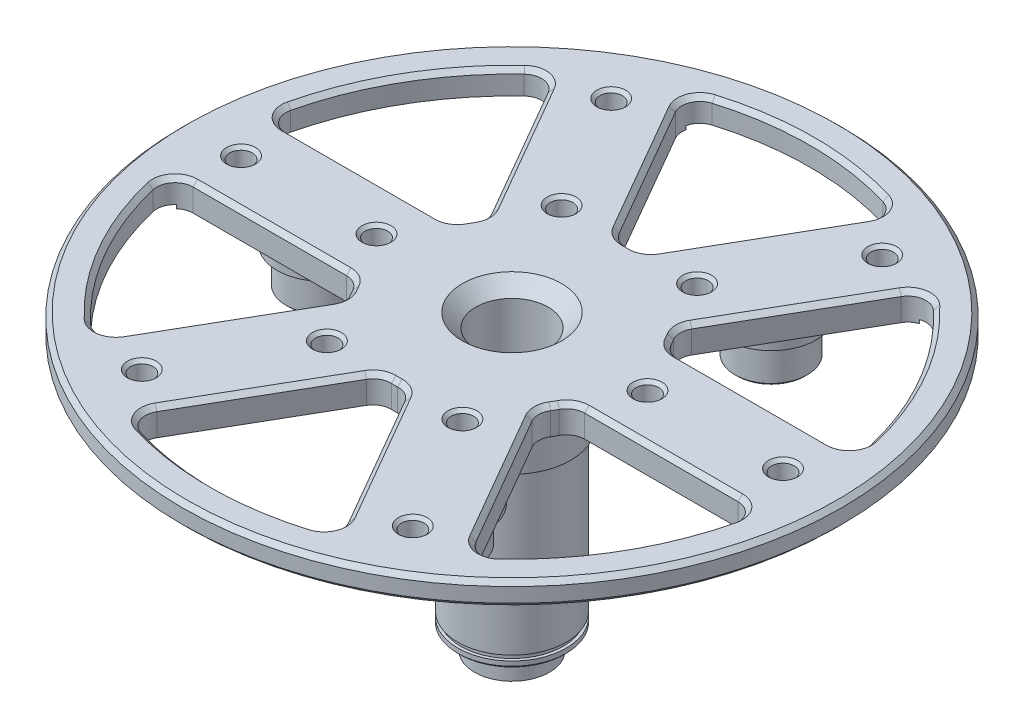
from build123d import *

# Parameters (mm, degrees)
CHAMFER1_SIZE                   = 0.5
CHAMFER2_SIZE                   = 0.25
CIRPATTERN1_COUNT               = 3
CHAMFER2_OF_CIRPATTERN1_SIZE    = 0.25
CHAMFER3_SIZE                   = 0.25
CHAMFER4_SIZE                   = 0.5
M3X0_5_TAPPED_HOLE1_D           = 2.5
M3X0_5_TAPPED_HOLE1_CSINK_D     = 3.2
M3X0_5_TAPPED_HOLE1_CSINK_ANGLE = 90
M3X0_5_TAPPED_HOLE2_D           = 2.5
M3X0_5_TAPPED_HOLE2_CSINK_D     = 3.2
M3X0_5_TAPPED_HOLE2_CSINK_ANGLE = 90
CIRPATTERN2_COUNT               = 6
CUT_EXTRUDE1_DEPTH              = 57.490729328
FILLET1_R                       = 2
CHAMFER5_SIZE                   = 0.5
CIRPATTERN3_COUNT               = 6
FILLET1_OF_CIRPATTERN3_R        = 2
CHAMFER5_OF_CIRPATTERN3_SIZE    = 0.5


with BuildPart() as part:
    # Sketch1 → Revolve1 (revolve)
    with BuildSketch(Plane.XY, mode=Mode.PRIVATE) as revolve1_sk:
        Polygon((-2.5, -6), (-4, -6), (-4, 21.45), (-5.5, 22.95), (-36.5, 22.95), (-36.5, 20.35), (-32, 20.35), (-32, 19.95), (-6.5, 19.95), (-6.5, 12), (-6, 12), (-6, -5.69), (-5.67, -5.69), (-5.67, -6.25), (-6, -6.25), (-6, -7), (-4.15, -7), (-4.15, -9.5), (-2.5, -9.5), align=None)
    revolve(revolve1_sk.sketch.rotate(Axis((0, 0, 0), (0, -1, 0)), 270), axis=Axis((0, 0, 0), (0, -1, 0)))

    # Chamfer1
    chamfer1_edges = [part.edges().sort_by_distance(p)[0] for p in [
        (0, -9.5, -2.5),
    ]]
    chamfer(chamfer1_edges, length=CHAMFER1_SIZE)

    # Sketch2 → Planet bearing axis (revolve)
    with BuildSketch(Plane.XY):
        Polygon((-21, 19.95), (-26, 19.95), (-26, 18.95), (-25, 18.95), (-25, 14.85), (-21, 14.85), align=None)
    planet_bearing_axis = revolve(axis=Axis((-21, 33.164090746, 0), (0, -1, 0)))

    # Chamfer2
    chamfer2_edges = [part.edges().sort_by_distance(p)[0] for p in [
        (-17, 14.85, 0),
    ]]
    chamfer(chamfer2_edges, length=CHAMFER2_SIZE)

    # CirPattern1: Planet bearing axis ×3 about axis
    cirpattern1_axis = Axis((0, 0, 0), (0, 1, 0))
    for i in range(1, CIRPATTERN1_COUNT):
        add(planet_bearing_axis.rotate(cirpattern1_axis, i * 360 / CIRPATTERN1_COUNT))

    # Chamfer2 of CirPattern1
    chamfer2_of_cirpattern1_edges = [part.edges().sort_by_distance(p)[0] for p in [
        (8.5, 14.85, 14.722431864),
        (8.5, 14.85, -14.722431864),
    ]]
    chamfer(chamfer2_of_cirpattern1_edges, length=CHAMFER2_OF_CIRPATTERN1_SIZE)

    # Chamfer3
    chamfer3_edges = [part.edges().sort_by_distance(p)[0] for p in [
        (0, -7, -6),
    ]]
    chamfer(chamfer3_edges, length=CHAMFER3_SIZE)

    # Chamfer4
    chamfer4_edges = [part.edges().sort_by_distance(p)[0] for p in [
        (0, 19.95, -6.5),
        (0, 20.35, -36.5),
        (0, 22.95, -36.5),
    ]]
    chamfer(chamfer4_edges, length=CHAMFER4_SIZE)

    # M3x0.5 Tapped Hole1 (through all)
    with Locations(Plane(origin=(0, 22.95, 0), x_dir=(1, 0, 0), z_dir=(0, 1, 0))):
        with Locations((-30, 0)):
            m3x0_5_tapped_hole1 = CounterSinkHole(M3X0_5_TAPPED_HOLE1_D / 2, M3X0_5_TAPPED_HOLE1_CSINK_D / 2, counter_sink_angle=M3X0_5_TAPPED_HOLE1_CSINK_ANGLE)

    # M3x0.5 Tapped Hole2 (through all)
    with Locations(Plane(origin=(0, 22.95, 0), x_dir=(1, 0, 0), z_dir=(0, 1, 0))):
        with Locations((-15, 0)):
            m3x0_5_tapped_hole2 = CounterSinkHole(M3X0_5_TAPPED_HOLE2_D / 2, M3X0_5_TAPPED_HOLE2_CSINK_D / 2, counter_sink_angle=M3X0_5_TAPPED_HOLE2_CSINK_ANGLE)

    # CirPattern2: M3x0.5 Tapped Hole1, M3x0.5 Tapped Hole2 ×6 about axis
    cirpattern2_axis = Axis((0, 0, 0), (0, 1, 0))
    add([m3x0_5_tapped_hole1.rotate(cirpattern2_axis, i * 360 / CIRPATTERN2_COUNT) for i in range(1, CIRPATTERN2_COUNT)], mode=Mode.SUBTRACT)
    add([m3x0_5_tapped_hole2.rotate(cirpattern2_axis, i * 360 / CIRPATTERN2_COUNT) for i in range(1, CIRPATTERN2_COUNT)], mode=Mode.SUBTRACT)

    # Sketch7 → Cut-Extrude1 (cut, through all)
    with BuildSketch(Plane(origin=(0, 0, 0), x_dir=(1, 0, 0), z_dir=(0, 1, 0))):
        with BuildLine():
            Line((-20.758359751, -25.653274653), (-10.428637185, -7.76167034))
            ThreePointArc((-10.428637185, -7.76167034), (-11.258330249, -6.5), (-11.936122283, -5.150629559))
            Line((-11.936122283, -5.150629559), (-32.595567416, -5.150629559))
            ThreePointArc((-32.595567416, -5.150629559), (-28.578838325, -16.5), (-20.758359751, -25.653274653))
        make_face()
    cut_extrude1 = extrude(amount=CUT_EXTRUDE1_DEPTH, mode=Mode.SUBTRACT)

    # Fillet1
    # the kernel refuses this fillet: 2 mm, written as the material it adds along each edge
    with BuildSketch(Plane(origin=(-20.758359751, 14.078120483, 25.653274653), x_dir=(-0.7528994258990811, 0, -0.6581355897387968), z_dir=(0, 1, 0))) as fillet1_piece_1_section:
        with BuildLine():
            CenterArc((2.432729025, -1.998554612), FILLET1_R, 87.82158292, 103.336253881)
            Line((0.470533377, -2.385579466), (0, 0))
            ThreePointArc((0, 0), (1.254375903, 0.023848904), (2.508751807, 0))
        make_face()
    fillet1_piece_1 = extrude(amount=8.871879517, mode=Mode.PRIVATE)
    fillet1_piece_1 = split(fillet1_piece_1, bisect_by=Plane(origin=(-20.132712931, 19.95, 24.335112466), z_dir=(0, 1, 0)), keep=Keep.TOP, mode=Mode.PRIVATE)
    fillet1_piece_1 = fillet1_piece_1 & Plane(origin=(0, 20.15, 0), x_dir=(0, 0, 1), z_dir=(0, -1, 0)) * Cylinder(32, 28, mode=Mode.PRIVATE)
    fillet1_piece_1 = split(fillet1_piece_1, bisect_by=Plane(origin=(-20.132712931, 20.35, 24.335112466), z_dir=(0, -1, 0)), keep=Keep.TOP, mode=Mode.PRIVATE)
    add(fillet1_piece_1)
    with BuildSketch(Plane(origin=(-20.758359751, 20.35, 25.653274653), x_dir=(-0.7528994258990804, 0, -0.6581355897387977), z_dir=(0, 1, 0))) as fillet1_piece_2_section:
        with BuildLine():
            CenterArc((2.432729025, -1.998554612), FILLET1_R, 87.82158292, 103.336253881)
            Line((0.470533377, -2.385579466), (0, 0))
            ThreePointArc((0, 0), (1.254375903, 0.023848904), (2.508751807, 0))
        make_face()
    fillet1_piece_2 = extrude(amount=2.6, mode=Mode.PRIVATE)
    fillet1_piece_2 = fillet1_piece_2 - Plane(origin=(0, 21.65, 0), x_dir=(0, 0, 1), z_dir=(0, -1, 0)) * Cylinder(32, 16, mode=Mode.PRIVATE)
    add(fillet1_piece_2)
    with BuildSketch(Plane(origin=(-20.758359751, 20.35, 25.653274653), x_dir=(-0.7528994258990804, 0, -0.6581355897387977), z_dir=(0, 1, 0))) as fillet1_piece_3_section:
        with BuildLine():
            CenterArc((2.432729025, -1.998554612), FILLET1_R, 87.82158292, 103.336253881)
            Line((0.470533377, -2.385579466), (0, 0))
            ThreePointArc((0, 0), (1.254375903, 0.023848904), (2.508751807, 0))
        make_face()
    fillet1_piece_3 = extrude(amount=2.6, mode=Mode.PRIVATE)
    fillet1_piece_3 = fillet1_piece_3 & Plane(origin=(0, 21.65, 0), x_dir=(0, 0, 1), z_dir=(0, -1, 0)) * Cylinder(32, 16, mode=Mode.PRIVATE)
    add(fillet1_piece_3)
    with BuildSketch(Plane(origin=(-32.595567416, 14.078120483, 5.150629559), x_dir=(0.19351242689891437, 0, 0.9810978241927216), z_dir=(0, 1, 0))) as fillet1_piece_4_section:
        with BuildLine():
            CenterArc((2.432729025, 1.998554612), FILLET1_R, 168.842163199, 103.336253881)
            Line((0.470533377, 2.385579466), (0, 0))
            ThreePointArc((0, 0), (1.254375903, -0.023848904), (2.508751807, 0))
        make_face()
    fillet1_piece_4 = extrude(amount=8.871879517, mode=Mode.PRIVATE)
    fillet1_piece_4 = split(fillet1_piece_4, bisect_by=Plane(origin=(-31.141182065, 19.95, 5.267884612), z_dir=(0, 1, 0)), keep=Keep.TOP, mode=Mode.PRIVATE)
    fillet1_piece_4 = fillet1_piece_4 & Plane(origin=(0, 20.15, 0), x_dir=(0, 0, 1), z_dir=(0, -1, 0)) * Cylinder(32, 28, mode=Mode.PRIVATE)
    fillet1_piece_4 = split(fillet1_piece_4, bisect_by=Plane(origin=(-31.141182065, 20.35, 5.267884612), z_dir=(0, -1, 0)), keep=Keep.TOP, mode=Mode.PRIVATE)
    add(fillet1_piece_4)
    with BuildSketch(Plane(origin=(-32.595567416, 20.35, 5.150629559), x_dir=(0.19351242689891449, 0, 0.9810978241927214), z_dir=(0, 1, 0))) as fillet1_piece_5_section:
        with BuildLine():
            CenterArc((2.432729025, 1.998554612), FILLET1_R, 168.842163199, 103.336253881)
            Line((0.470533377, 2.385579466), (0, 0))
            ThreePointArc((0, 0), (1.254375903, -0.023848904), (2.508751807, 0))
        make_face()
    fillet1_piece_5 = extrude(amount=2.6, mode=Mode.PRIVATE)
    fillet1_piece_5 = fillet1_piece_5 - Plane(origin=(0, 21.65, 0), x_dir=(0, 0, 1), z_dir=(0, -1, 0)) * Cylinder(32, 16, mode=Mode.PRIVATE)
    add(fillet1_piece_5)
    with BuildSketch(Plane(origin=(-32.595567416, 20.35, 5.150629559), x_dir=(0.19351242689891449, 0, 0.9810978241927214), z_dir=(0, 1, 0))) as fillet1_piece_6_section:
        with BuildLine():
            CenterArc((2.432729025, 1.998554612), FILLET1_R, 168.842163199, 103.336253881)
            Line((0.470533377, 2.385579466), (0, 0))
            ThreePointArc((0, 0), (1.254375903, -0.023848904), (2.508751807, 0))
        make_face()
    fillet1_piece_6 = extrude(amount=2.6, mode=Mode.PRIVATE)
    fillet1_piece_6 = fillet1_piece_6 & Plane(origin=(0, 21.65, 0), x_dir=(0, 0, 1), z_dir=(0, -1, 0)) * Cylinder(32, 16, mode=Mode.PRIVATE)
    add(fillet1_piece_6)
    with BuildSketch(Plane(origin=(-10.428637185, 19.95, 7.76167034), x_dir=(-0.5605549109319616, 0, -0.8281172572951614), z_dir=(0, 1, 0))) as fillet1_piece_7:
        with BuildLine():
            CenterArc((1.252998634, 1.997996438), FILLET1_R, 205.905817779, 61.529342356)
            Line((-0.546028209, 1.124210185), (0, 0))
            ThreePointArc((0, 0), (0.581749366, 0.013023151), (1.163498732, 0))
        make_face()
    extrude(amount=3)
    with BuildSketch(Plane(origin=(-11.936122283, 19.95, 5.150629559), x_dir=(-1, 0, 0), z_dir=(0, 1, 0))) as fillet1_piece_8:
        with BuildLine():
            CenterArc((1.249798122, 2), FILLET1_R, 208.470657644, 61.529342356)
            ThreePointArc((-0.508324599, 1.046582726), (-0.2424478, 0.528981088), (0, 0))
            Line((0, 0), (1.249798122, 0))
        make_face()
    extrude(amount=3)

    # Chamfer5
    chamfer5_edges = [part.edges().sort_by_distance(p)[0] for p in [
        (-28.578838325, 22.95, 16.5),
        (-15.298062779, 22.95, 16.195762873),
        (-21.674973471, 22.95, 5.150629559),
        (-11.258330249, 22.95, 6.5),
        (-20.984826836, 22.95, 24.526389146),
        (-31.732889482, 22.95, 5.910198561),
        (-10.785765167, 22.95, 7.817335996),
        (-12.162894146, 22.95, 5.432078636),
    ]]
    chamfer(chamfer5_edges, length=CHAMFER5_SIZE)

    # CirPattern3: Cut-Extrude1 ×6 about axis
    cirpattern3_axis = Axis((0, 0, 0), (0, 1, 0))
    for i in range(1, CIRPATTERN3_COUNT):
        add(cut_extrude1.rotate(cirpattern3_axis, i * 360 / CIRPATTERN3_COUNT), mode=Mode.SUBTRACT)

    # Fillet1 of CirPattern3
    # the kernel refuses this fillet: 2 mm, written as the material it adds along each edge
    with BuildSketch(Plane(origin=(11.837207665, 14.078120483, 30.803904212), x_dir=(-0.499999999999998, 0, -0.8660254037844397), z_dir=(0, 1, 0))) as fillet1_of_cirpattern3_piece_1_section:
        with BuildLine():
            CenterArc((2.431540879, 2), FILLET1_OF_CIRPATTERN3_R, 166.663746119, 103.336253881)
            ThreePointArc((0.485474651, 2.461330939), (0.219339217, 1.235280529), (0, 0))
            Line((0, 0), (2.431540879, 0))
        make_face()
    fillet1_of_cirpattern3_piece_1 = extrude(amount=8.871879517, mode=Mode.PRIVATE)
    fillet1_of_cirpattern3_piece_1 = split(fillet1_of_cirpattern3_piece_1, bisect_by=Plane(origin=(11.008469134, 19.95, 29.602997078), z_dir=(0, 1, 0)), keep=Keep.TOP, mode=Mode.PRIVATE)
    fillet1_of_cirpattern3_piece_1 = split(fillet1_of_cirpattern3_piece_1, bisect_by=Plane(origin=(11.008469134, 20.35, 29.602997078), z_dir=(0, -1, 0)), keep=Keep.TOP, mode=Mode.PRIVATE)
    fillet1_of_cirpattern3_piece_1 = fillet1_of_cirpattern3_piece_1 & Plane(origin=(0, 20.15, 0), x_dir=(0, 0, 1), z_dir=(0, -1, 0)) * Cylinder(32, 28, mode=Mode.PRIVATE)
    add(fillet1_of_cirpattern3_piece_1)
    with BuildSketch(Plane(origin=(11.837207665, 20.35, 30.803904212), x_dir=(-0.499999999999998, 0, -0.8660254037844397), z_dir=(0, 1, 0))) as fillet1_of_cirpattern3_piece_2_section:
        with BuildLine():
            CenterArc((2.431540879, 2), FILLET1_OF_CIRPATTERN3_R, 166.663746119, 103.336253881)
            ThreePointArc((0.485474651, 2.461330939), (0.219339217, 1.235280529), (0, 0))
            Line((0, 0), (2.431540879, 0))
        make_face()
    fillet1_of_cirpattern3_piece_2 = extrude(amount=2.6, mode=Mode.PRIVATE)
    fillet1_of_cirpattern3_piece_2 = fillet1_of_cirpattern3_piece_2 & Plane(origin=(0, 21.65, 0), x_dir=(0, 0, 1), z_dir=(0, -1, 0)) * Cylinder(32, 16, mode=Mode.PRIVATE)
    add(fillet1_of_cirpattern3_piece_2)
    with BuildSketch(Plane(origin=(11.837207665, 20.35, 30.803904212), x_dir=(-0.499999999999998, 0, -0.8660254037844397), z_dir=(0, 1, 0))) as fillet1_of_cirpattern3_piece_3_section:
        with BuildLine():
            CenterArc((2.431540879, 2), FILLET1_OF_CIRPATTERN3_R, 166.663746119, 103.336253881)
            ThreePointArc((0.485474651, 2.461330939), (0.219339217, 1.235280529), (0, 0))
            Line((0, 0), (2.431540879, 0))
        make_face()
    fillet1_of_cirpattern3_piece_3 = extrude(amount=2.6, mode=Mode.PRIVATE)
    fillet1_of_cirpattern3_piece_3 = fillet1_of_cirpattern3_piece_3 - Plane(origin=(0, 21.65, 0), x_dir=(0, 0, 1), z_dir=(0, -1, 0)) * Cylinder(32, 16, mode=Mode.PRIVATE)
    add(fillet1_of_cirpattern3_piece_3)
    with BuildSketch(Plane(origin=(-11.837207665, 14.078120483, 30.803904212), x_dir=(0.49999999999999845, 0, -0.8660254037844395), z_dir=(0, 1, 0))) as fillet1_of_cirpattern3_piece_4_section:
        with BuildLine():
            CenterArc((2.431540879, -2), FILLET1_OF_CIRPATTERN3_R, 90, 103.336253881)
            ThreePointArc((0.485474651, -2.461330939), (0.219339217, -1.235280529), (0, 0))
            Line((0, 0), (2.431540879, 0))
        make_face()
    fillet1_of_cirpattern3_piece_4 = extrude(amount=8.871879517, mode=Mode.PRIVATE)
    fillet1_of_cirpattern3_piece_4 = split(fillet1_of_cirpattern3_piece_4, bisect_by=Plane(origin=(-11.008469134, 19.95, 29.602997078), z_dir=(0, 1, 0)), keep=Keep.TOP, mode=Mode.PRIVATE)
    fillet1_of_cirpattern3_piece_4 = fillet1_of_cirpattern3_piece_4 & Plane(origin=(0, 20.15, 0), x_dir=(0, 0, 1), z_dir=(0, -1, 0)) * Cylinder(32, 28, mode=Mode.PRIVATE)
    fillet1_of_cirpattern3_piece_4 = split(fillet1_of_cirpattern3_piece_4, bisect_by=Plane(origin=(-11.008469134, 20.35, 29.602997078), z_dir=(0, -1, 0)), keep=Keep.TOP, mode=Mode.PRIVATE)
    add(fillet1_of_cirpattern3_piece_4)
    with BuildSketch(Plane(origin=(-11.837207665, 20.35, 30.803904212), x_dir=(0.499999999999998, 0, -0.8660254037844397), z_dir=(0, 1, 0))) as fillet1_of_cirpattern3_piece_5_section:
        with BuildLine():
            CenterArc((2.431540879, -2), FILLET1_OF_CIRPATTERN3_R, 90, 103.336253881)
            ThreePointArc((0.485474651, -2.461330939), (0.219339217, -1.235280529), (0, 0))
            Line((0, 0), (2.431540879, 0))
        make_face()
    fillet1_of_cirpattern3_piece_5 = extrude(amount=2.6, mode=Mode.PRIVATE)
    fillet1_of_cirpattern3_piece_5 = fillet1_of_cirpattern3_piece_5 & Plane(origin=(0, 21.65, 0), x_dir=(0, 0, 1), z_dir=(0, -1, 0)) * Cylinder(32, 16, mode=Mode.PRIVATE)
    add(fillet1_of_cirpattern3_piece_5)
    with BuildSketch(Plane(origin=(-11.837207665, 20.35, 30.803904212), x_dir=(0.499999999999998, 0, -0.8660254037844397), z_dir=(0, 1, 0))) as fillet1_of_cirpattern3_piece_6_section:
        with BuildLine():
            CenterArc((2.431540879, -2), FILLET1_OF_CIRPATTERN3_R, 90, 103.336253881)
            ThreePointArc((0.485474651, -2.461330939), (0.219339217, -1.235280529), (0, 0))
            Line((0, 0), (2.431540879, 0))
        make_face()
    fillet1_of_cirpattern3_piece_6 = extrude(amount=2.6, mode=Mode.PRIVATE)
    fillet1_of_cirpattern3_piece_6 = fillet1_of_cirpattern3_piece_6 - Plane(origin=(0, 21.65, 0), x_dir=(0, 0, 1), z_dir=(0, -1, 0)) * Cylinder(32, 16, mode=Mode.PRIVATE)
    add(fillet1_of_cirpattern3_piece_6)
    with BuildSketch(Plane(origin=(1.507485098, 19.95, 12.912299899), x_dir=(-0.997448037595885, 0, 0.07139616443561987), z_dir=(0, 1, 0)), Plane(origin=(11.936122283, 19.95, 5.150629559), x_dir=(-0.43689312666392316, 0, 0.8995134217307829), z_dir=(0, 1, 0)), Plane(origin=(10.428637185, 19.95, -7.76167034), x_dir=(0.5605549109319609, 0, 0.828117257295162), z_dir=(0, 1, 0)), Plane(origin=(-1.507485098, 19.95, -12.912299899), x_dir=(0.997448037595885, 0, -0.07139616443562116), z_dir=(0, 1, 0)), Plane(origin=(-11.936122283, 19.95, -5.150629559), x_dir=(0.43689312666392466, 0, -0.8995134217307821), z_dir=(0, 1, 0))) as fillet1_of_cirpattern3_piece_7:
        with BuildLine():
            CenterArc((1.252998634, 1.997996438), FILLET1_OF_CIRPATTERN3_R, 205.905817779, 61.529342356)
            Line((-0.546028209, 1.124210185), (0, 0))
            ThreePointArc((0, 0), (0.581749366, 0.013023151), (1.163498732, 0))
        make_face()
    extrude(amount=3)
    with BuildSketch(Plane(origin=(-1.507485098, 19.95, 12.912299899), x_dir=(-0.49999999999999867, 0, 0.8660254037844395), z_dir=(0, 1, 0)), Plane(origin=(10.428637185, 19.95, 7.76167034), x_dir=(0.5000000000000017, 0, 0.8660254037844377), z_dir=(0, 1, 0)), Plane(origin=(11.936122283, 19.95, -5.150629559), x_dir=(1, 0, 0), z_dir=(0, 1, 0)), Plane(origin=(1.507485098, 19.95, -12.912299899), x_dir=(0.499999999999999, 0, -0.8660254037844393), z_dir=(0, 1, 0)), Plane(origin=(-10.428637185, 19.95, -7.76167034), x_dir=(-0.5000000000000011, 0, -0.866025403784438), z_dir=(0, 1, 0))) as fillet1_of_cirpattern3_piece_8:
        with BuildLine():
            CenterArc((1.249798122, 2), FILLET1_OF_CIRPATTERN3_R, 208.470657644, 61.529342356)
            ThreePointArc((-0.508324599, 1.046582726), (-0.2424478, 0.528981088), (0, 0))
            Line((0, 0), (1.249798122, 0))
        make_face()
    extrude(amount=3)
    with BuildSketch(Plane(origin=(32.595567416, 14.078120483, 5.150629559), x_dir=(-1, 0, 0), z_dir=(0, 1, 0))) as fillet1_of_cirpattern3_piece_9_section:
        with BuildLine():
            CenterArc((2.431540879, 2), FILLET1_OF_CIRPATTERN3_R, 166.663746119, 103.336253881)
            ThreePointArc((0.485474651, 2.461330939), (0.219339217, 1.235280529), (0, 0))
            Line((0, 0), (2.431540879, 0))
        make_face()
    fillet1_of_cirpattern3_piece_9 = extrude(amount=8.871879517, mode=Mode.PRIVATE)
    fillet1_of_cirpattern3_piece_9 = split(fillet1_of_cirpattern3_piece_9, bisect_by=Plane(origin=(31.141182065, 19.95, 5.267884612), z_dir=(0, 1, 0)), keep=Keep.TOP, mode=Mode.PRIVATE)
    fillet1_of_cirpattern3_piece_9 = split(fillet1_of_cirpattern3_piece_9, bisect_by=Plane(origin=(31.141182065, 20.35, 5.267884612), z_dir=(0, -1, 0)), keep=Keep.TOP, mode=Mode.PRIVATE)
    fillet1_of_cirpattern3_piece_9 = fillet1_of_cirpattern3_piece_9 & Plane(origin=(0, 20.15, 0), x_dir=(0, 0, 1), z_dir=(0, -1, 0)) * Cylinder(32, 28, mode=Mode.PRIVATE)
    add(fillet1_of_cirpattern3_piece_9)
    with BuildSketch(Plane(origin=(32.595567416, 20.35, 5.150629559), x_dir=(-1, 0, 0), z_dir=(0, 1, 0))) as fillet1_of_cirpattern3_piece_10_section:
        with BuildLine():
            CenterArc((2.431540879, 2), FILLET1_OF_CIRPATTERN3_R, 166.663746119, 103.336253881)
            ThreePointArc((0.485474651, 2.461330939), (0.219339217, 1.235280529), (0, 0))
            Line((0, 0), (2.431540879, 0))
        make_face()
    fillet1_of_cirpattern3_piece_10 = extrude(amount=2.6, mode=Mode.PRIVATE)
    fillet1_of_cirpattern3_piece_10 = fillet1_of_cirpattern3_piece_10 & Plane(origin=(0, 21.65, 0), x_dir=(0, 0, 1), z_dir=(0, -1, 0)) * Cylinder(32, 16, mode=Mode.PRIVATE)
    add(fillet1_of_cirpattern3_piece_10)
    with BuildSketch(Plane(origin=(32.595567416, 20.35, 5.150629559), x_dir=(-1, 0, 0), z_dir=(0, 1, 0))) as fillet1_of_cirpattern3_piece_11_section:
        with BuildLine():
            CenterArc((2.431540879, 2), FILLET1_OF_CIRPATTERN3_R, 166.663746119, 103.336253881)
            ThreePointArc((0.485474651, 2.461330939), (0.219339217, 1.235280529), (0, 0))
            Line((0, 0), (2.431540879, 0))
        make_face()
    fillet1_of_cirpattern3_piece_11 = extrude(amount=2.6, mode=Mode.PRIVATE)
    fillet1_of_cirpattern3_piece_11 = fillet1_of_cirpattern3_piece_11 - Plane(origin=(0, 21.65, 0), x_dir=(0, 0, 1), z_dir=(0, -1, 0)) * Cylinder(32, 16, mode=Mode.PRIVATE)
    add(fillet1_of_cirpattern3_piece_11)
    with BuildSketch(Plane(origin=(20.758359751, 14.078120483, 25.653274653), x_dir=(-0.5000000000000023, 0, -0.8660254037844372), z_dir=(0, 1, 0))) as fillet1_of_cirpattern3_piece_12_section:
        with BuildLine():
            CenterArc((2.431540879, -2), FILLET1_OF_CIRPATTERN3_R, 90, 103.336253881)
            ThreePointArc((0.485474651, -2.461330939), (0.219339217, -1.235280529), (0, 0))
            Line((0, 0), (2.431540879, 0))
        make_face()
    fillet1_of_cirpattern3_piece_12 = extrude(amount=8.871879517, mode=Mode.PRIVATE)
    fillet1_of_cirpattern3_piece_12 = split(fillet1_of_cirpattern3_piece_12, bisect_by=Plane(origin=(20.132712931, 19.95, 24.335112466), z_dir=(0, 1, 0)), keep=Keep.TOP, mode=Mode.PRIVATE)
    fillet1_of_cirpattern3_piece_12 = fillet1_of_cirpattern3_piece_12 & Plane(origin=(0, 20.15, 0), x_dir=(0, 0, 1), z_dir=(0, -1, 0)) * Cylinder(32, 28, mode=Mode.PRIVATE)
    fillet1_of_cirpattern3_piece_12 = split(fillet1_of_cirpattern3_piece_12, bisect_by=Plane(origin=(20.132712931, 20.35, 24.335112466), z_dir=(0, -1, 0)), keep=Keep.TOP, mode=Mode.PRIVATE)
    add(fillet1_of_cirpattern3_piece_12)
    with BuildSketch(Plane(origin=(20.758359751, 20.35, 25.653274653), x_dir=(-0.5000000000000014, 0, -0.8660254037844377), z_dir=(0, 1, 0))) as fillet1_of_cirpattern3_piece_13_section:
        with BuildLine():
            CenterArc((2.431540879, -2), FILLET1_OF_CIRPATTERN3_R, 90, 103.336253881)
            ThreePointArc((0.485474651, -2.461330939), (0.219339217, -1.235280529), (0, 0))
            Line((0, 0), (2.431540879, 0))
        make_face()
    fillet1_of_cirpattern3_piece_13 = extrude(amount=2.6, mode=Mode.PRIVATE)
    fillet1_of_cirpattern3_piece_13 = fillet1_of_cirpattern3_piece_13 & Plane(origin=(0, 21.65, 0), x_dir=(0, 0, 1), z_dir=(0, -1, 0)) * Cylinder(32, 16, mode=Mode.PRIVATE)
    add(fillet1_of_cirpattern3_piece_13)
    with BuildSketch(Plane(origin=(20.758359751, 20.35, 25.653274653), x_dir=(-0.5000000000000014, 0, -0.8660254037844377), z_dir=(0, 1, 0))) as fillet1_of_cirpattern3_piece_14_section:
        with BuildLine():
            CenterArc((2.431540879, -2), FILLET1_OF_CIRPATTERN3_R, 90, 103.336253881)
            ThreePointArc((0.485474651, -2.461330939), (0.219339217, -1.235280529), (0, 0))
            Line((0, 0), (2.431540879, 0))
        make_face()
    fillet1_of_cirpattern3_piece_14 = extrude(amount=2.6, mode=Mode.PRIVATE)
    fillet1_of_cirpattern3_piece_14 = fillet1_of_cirpattern3_piece_14 - Plane(origin=(0, 21.65, 0), x_dir=(0, 0, 1), z_dir=(0, -1, 0)) * Cylinder(32, 16, mode=Mode.PRIVATE)
    add(fillet1_of_cirpattern3_piece_14)
    with BuildSketch(Plane(origin=(20.758359751, 14.078120483, -25.653274653), x_dir=(-0.5000000000000026, 0, 0.8660254037844372), z_dir=(0, 1, 0))) as fillet1_of_cirpattern3_piece_15_section:
        with BuildLine():
            CenterArc((2.431540879, 2), FILLET1_OF_CIRPATTERN3_R, 166.663746119, 103.336253881)
            ThreePointArc((0.485474651, 2.461330939), (0.219339217, 1.235280529), (0, 0))
            Line((0, 0), (2.431540879, 0))
        make_face()
    fillet1_of_cirpattern3_piece_15 = extrude(amount=8.871879517, mode=Mode.PRIVATE)
    fillet1_of_cirpattern3_piece_15 = split(fillet1_of_cirpattern3_piece_15, bisect_by=Plane(origin=(20.132712931, 19.95, -24.335112466), z_dir=(0, 1, 0)), keep=Keep.TOP, mode=Mode.PRIVATE)
    fillet1_of_cirpattern3_piece_15 = split(fillet1_of_cirpattern3_piece_15, bisect_by=Plane(origin=(20.132712931, 20.35, -24.335112466), z_dir=(0, -1, 0)), keep=Keep.TOP, mode=Mode.PRIVATE)
    fillet1_of_cirpattern3_piece_15 = fillet1_of_cirpattern3_piece_15 & Plane(origin=(0, 20.15, 0), x_dir=(0, 0, 1), z_dir=(0, -1, 0)) * Cylinder(32, 28, mode=Mode.PRIVATE)
    add(fillet1_of_cirpattern3_piece_15)
    with BuildSketch(Plane(origin=(20.758359751, 20.35, -25.653274653), x_dir=(-0.5000000000000014, 0, 0.8660254037844377), z_dir=(0, 1, 0))) as fillet1_of_cirpattern3_piece_16_section:
        with BuildLine():
            CenterArc((2.431540879, 2), FILLET1_OF_CIRPATTERN3_R, 166.663746119, 103.336253881)
            ThreePointArc((0.485474651, 2.461330939), (0.219339217, 1.235280529), (0, 0))
            Line((0, 0), (2.431540879, 0))
        make_face()
    fillet1_of_cirpattern3_piece_16 = extrude(amount=2.6, mode=Mode.PRIVATE)
    fillet1_of_cirpattern3_piece_16 = fillet1_of_cirpattern3_piece_16 & Plane(origin=(0, 21.65, 0), x_dir=(0, 0, 1), z_dir=(0, -1, 0)) * Cylinder(32, 16, mode=Mode.PRIVATE)
    add(fillet1_of_cirpattern3_piece_16)
    with BuildSketch(Plane(origin=(20.758359751, 20.35, -25.653274653), x_dir=(-0.5000000000000014, 0, 0.8660254037844377), z_dir=(0, 1, 0))) as fillet1_of_cirpattern3_piece_17_section:
        with BuildLine():
            CenterArc((2.431540879, 2), FILLET1_OF_CIRPATTERN3_R, 166.663746119, 103.336253881)
            ThreePointArc((0.485474651, 2.461330939), (0.219339217, 1.235280529), (0, 0))
            Line((0, 0), (2.431540879, 0))
        make_face()
    fillet1_of_cirpattern3_piece_17 = extrude(amount=2.6, mode=Mode.PRIVATE)
    fillet1_of_cirpattern3_piece_17 = fillet1_of_cirpattern3_piece_17 - Plane(origin=(0, 21.65, 0), x_dir=(0, 0, 1), z_dir=(0, -1, 0)) * Cylinder(32, 16, mode=Mode.PRIVATE)
    add(fillet1_of_cirpattern3_piece_17)
    with BuildSketch(Plane(origin=(32.595567416, 14.078120483, -5.150629559), x_dir=(-1, 0, 0), z_dir=(0, 1, 0))) as fillet1_of_cirpattern3_piece_18_section:
        with BuildLine():
            CenterArc((2.431540879, -2), FILLET1_OF_CIRPATTERN3_R, 90, 103.336253881)
            ThreePointArc((0.485474651, -2.461330939), (0.219339217, -1.235280529), (0, 0))
            Line((0, 0), (2.431540879, 0))
        make_face()
    fillet1_of_cirpattern3_piece_18 = extrude(amount=8.871879517, mode=Mode.PRIVATE)
    fillet1_of_cirpattern3_piece_18 = split(fillet1_of_cirpattern3_piece_18, bisect_by=Plane(origin=(31.141182065, 19.95, -5.267884612), z_dir=(0, 1, 0)), keep=Keep.TOP, mode=Mode.PRIVATE)
    fillet1_of_cirpattern3_piece_18 = fillet1_of_cirpattern3_piece_18 & Plane(origin=(0, 20.15, 0), x_dir=(0, 0, 1), z_dir=(0, -1, 0)) * Cylinder(32, 28, mode=Mode.PRIVATE)
    fillet1_of_cirpattern3_piece_18 = split(fillet1_of_cirpattern3_piece_18, bisect_by=Plane(origin=(31.141182065, 20.35, -5.267884612), z_dir=(0, -1, 0)), keep=Keep.TOP, mode=Mode.PRIVATE)
    add(fillet1_of_cirpattern3_piece_18)
    with BuildSketch(Plane(origin=(32.595567416, 20.35, -5.150629559), x_dir=(-1, 0, 0), z_dir=(0, 1, 0))) as fillet1_of_cirpattern3_piece_19_section:
        with BuildLine():
            CenterArc((2.431540879, -2), FILLET1_OF_CIRPATTERN3_R, 90, 103.336253881)
            ThreePointArc((0.485474651, -2.461330939), (0.219339217, -1.235280529), (0, 0))
            Line((0, 0), (2.431540879, 0))
        make_face()
    fillet1_of_cirpattern3_piece_19 = extrude(amount=2.6, mode=Mode.PRIVATE)
    fillet1_of_cirpattern3_piece_19 = fillet1_of_cirpattern3_piece_19 & Plane(origin=(0, 21.65, 0), x_dir=(0, 0, 1), z_dir=(0, -1, 0)) * Cylinder(32, 16, mode=Mode.PRIVATE)
    add(fillet1_of_cirpattern3_piece_19)
    with BuildSketch(Plane(origin=(32.595567416, 20.35, -5.150629559), x_dir=(-1, 0, 0), z_dir=(0, 1, 0))) as fillet1_of_cirpattern3_piece_20_section:
        with BuildLine():
            CenterArc((2.431540879, -2), FILLET1_OF_CIRPATTERN3_R, 90, 103.336253881)
            ThreePointArc((0.485474651, -2.461330939), (0.219339217, -1.235280529), (0, 0))
            Line((0, 0), (2.431540879, 0))
        make_face()
    fillet1_of_cirpattern3_piece_20 = extrude(amount=2.6, mode=Mode.PRIVATE)
    fillet1_of_cirpattern3_piece_20 = fillet1_of_cirpattern3_piece_20 - Plane(origin=(0, 21.65, 0), x_dir=(0, 0, 1), z_dir=(0, -1, 0)) * Cylinder(32, 16, mode=Mode.PRIVATE)
    add(fillet1_of_cirpattern3_piece_20)
    with BuildSketch(Plane(origin=(-11.837207665, 14.078120483, -30.803904212), x_dir=(0.4999999999999979, 0, 0.8660254037844398), z_dir=(0, 1, 0))) as fillet1_of_cirpattern3_piece_21_section:
        with BuildLine():
            CenterArc((2.431540879, 2), FILLET1_OF_CIRPATTERN3_R, 166.663746119, 103.336253881)
            ThreePointArc((0.485474651, 2.461330939), (0.219339217, 1.235280529), (0, 0))
            Line((0, 0), (2.431540879, 0))
        make_face()
    fillet1_of_cirpattern3_piece_21 = extrude(amount=8.871879517, mode=Mode.PRIVATE)
    fillet1_of_cirpattern3_piece_21 = split(fillet1_of_cirpattern3_piece_21, bisect_by=Plane(origin=(-11.008469134, 19.95, -29.602997078), z_dir=(0, 1, 0)), keep=Keep.TOP, mode=Mode.PRIVATE)
    fillet1_of_cirpattern3_piece_21 = split(fillet1_of_cirpattern3_piece_21, bisect_by=Plane(origin=(-11.008469134, 20.35, -29.602997078), z_dir=(0, -1, 0)), keep=Keep.TOP, mode=Mode.PRIVATE)
    fillet1_of_cirpattern3_piece_21 = fillet1_of_cirpattern3_piece_21 & Plane(origin=(0, 20.15, 0), x_dir=(0, 0, 1), z_dir=(0, -1, 0)) * Cylinder(32, 28, mode=Mode.PRIVATE)
    add(fillet1_of_cirpattern3_piece_21)
    with BuildSketch(Plane(origin=(-11.837207665, 20.35, -30.803904212), x_dir=(0.499999999999998, 0, 0.8660254037844397), z_dir=(0, 1, 0))) as fillet1_of_cirpattern3_piece_22_section:
        with BuildLine():
            CenterArc((2.431540879, 2), FILLET1_OF_CIRPATTERN3_R, 166.663746119, 103.336253881)
            ThreePointArc((0.485474651, 2.461330939), (0.219339217, 1.235280529), (0, 0))
            Line((0, 0), (2.431540879, 0))
        make_face()
    fillet1_of_cirpattern3_piece_22 = extrude(amount=2.6, mode=Mode.PRIVATE)
    fillet1_of_cirpattern3_piece_22 = fillet1_of_cirpattern3_piece_22 & Plane(origin=(0, 21.65, 0), x_dir=(0, 0, 1), z_dir=(0, -1, 0)) * Cylinder(32, 16, mode=Mode.PRIVATE)
    add(fillet1_of_cirpattern3_piece_22)
    with BuildSketch(Plane(origin=(-11.837207665, 20.35, -30.803904212), x_dir=(0.499999999999998, 0, 0.8660254037844397), z_dir=(0, 1, 0))) as fillet1_of_cirpattern3_piece_23_section:
        with BuildLine():
            CenterArc((2.431540879, 2), FILLET1_OF_CIRPATTERN3_R, 166.663746119, 103.336253881)
            ThreePointArc((0.485474651, 2.461330939), (0.219339217, 1.235280529), (0, 0))
            Line((0, 0), (2.431540879, 0))
        make_face()
    fillet1_of_cirpattern3_piece_23 = extrude(amount=2.6, mode=Mode.PRIVATE)
    fillet1_of_cirpattern3_piece_23 = fillet1_of_cirpattern3_piece_23 - Plane(origin=(0, 21.65, 0), x_dir=(0, 0, 1), z_dir=(0, -1, 0)) * Cylinder(32, 16, mode=Mode.PRIVATE)
    add(fillet1_of_cirpattern3_piece_23)
    with BuildSketch(Plane(origin=(11.837207665, 14.078120483, -30.803904212), x_dir=(-0.4999999999999979, 0, 0.8660254037844398), z_dir=(0, 1, 0))) as fillet1_of_cirpattern3_piece_24_section:
        with BuildLine():
            CenterArc((2.431540879, -2), FILLET1_OF_CIRPATTERN3_R, 90, 103.336253881)
            ThreePointArc((0.485474651, -2.461330939), (0.219339217, -1.235280529), (0, 0))
            Line((0, 0), (2.431540879, 0))
        make_face()
    fillet1_of_cirpattern3_piece_24 = extrude(amount=8.871879517, mode=Mode.PRIVATE)
    fillet1_of_cirpattern3_piece_24 = split(fillet1_of_cirpattern3_piece_24, bisect_by=Plane(origin=(11.008469134, 19.95, -29.602997078), z_dir=(0, 1, 0)), keep=Keep.TOP, mode=Mode.PRIVATE)
    fillet1_of_cirpattern3_piece_24 = fillet1_of_cirpattern3_piece_24 & Plane(origin=(0, 20.15, 0), x_dir=(0, 0, 1), z_dir=(0, -1, 0)) * Cylinder(32, 28, mode=Mode.PRIVATE)
    fillet1_of_cirpattern3_piece_24 = split(fillet1_of_cirpattern3_piece_24, bisect_by=Plane(origin=(11.008469134, 20.35, -29.602997078), z_dir=(0, -1, 0)), keep=Keep.TOP, mode=Mode.PRIVATE)
    add(fillet1_of_cirpattern3_piece_24)
    with BuildSketch(Plane(origin=(11.837207665, 20.35, -30.803904212), x_dir=(-0.4999999999999969, 0, 0.8660254037844406), z_dir=(0, 1, 0))) as fillet1_of_cirpattern3_piece_25_section:
        with BuildLine():
            CenterArc((2.431540879, -2), FILLET1_OF_CIRPATTERN3_R, 90, 103.336253881)
            ThreePointArc((0.485474651, -2.461330939), (0.219339217, -1.235280529), (0, 0))
            Line((0, 0), (2.431540879, 0))
        make_face()
    fillet1_of_cirpattern3_piece_25 = extrude(amount=2.6, mode=Mode.PRIVATE)
    fillet1_of_cirpattern3_piece_25 = fillet1_of_cirpattern3_piece_25 & Plane(origin=(0, 21.65, 0), x_dir=(0, 0, 1), z_dir=(0, -1, 0)) * Cylinder(32, 16, mode=Mode.PRIVATE)
    add(fillet1_of_cirpattern3_piece_25)
    with BuildSketch(Plane(origin=(11.837207665, 20.35, -30.803904212), x_dir=(-0.4999999999999969, 0, 0.8660254037844406), z_dir=(0, 1, 0))) as fillet1_of_cirpattern3_piece_26_section:
        with BuildLine():
            CenterArc((2.431540879, -2), FILLET1_OF_CIRPATTERN3_R, 90, 103.336253881)
            ThreePointArc((0.485474651, -2.461330939), (0.219339217, -1.235280529), (0, 0))
            Line((0, 0), (2.431540879, 0))
        make_face()
    fillet1_of_cirpattern3_piece_26 = extrude(amount=2.6, mode=Mode.PRIVATE)
    fillet1_of_cirpattern3_piece_26 = fillet1_of_cirpattern3_piece_26 - Plane(origin=(0, 21.65, 0), x_dir=(0, 0, 1), z_dir=(0, -1, 0)) * Cylinder(32, 16, mode=Mode.PRIVATE)
    add(fillet1_of_cirpattern3_piece_26)
    with BuildSketch(Plane(origin=(-32.595567416, 14.078120483, -5.150629559), x_dir=(1, 0, 0), z_dir=(0, 1, 0))) as fillet1_of_cirpattern3_piece_27_section:
        with BuildLine():
            CenterArc((2.431540879, 2), FILLET1_OF_CIRPATTERN3_R, 166.663746119, 103.336253881)
            ThreePointArc((0.485474651, 2.461330939), (0.219339217, 1.235280529), (0, 0))
            Line((0, 0), (2.431540879, 0))
        make_face()
    fillet1_of_cirpattern3_piece_27 = extrude(amount=8.871879517, mode=Mode.PRIVATE)
    fillet1_of_cirpattern3_piece_27 = split(fillet1_of_cirpattern3_piece_27, bisect_by=Plane(origin=(-31.141182065, 19.95, -5.267884612), z_dir=(0, 1, 0)), keep=Keep.TOP, mode=Mode.PRIVATE)
    fillet1_of_cirpattern3_piece_27 = split(fillet1_of_cirpattern3_piece_27, bisect_by=Plane(origin=(-31.141182065, 20.35, -5.267884612), z_dir=(0, -1, 0)), keep=Keep.TOP, mode=Mode.PRIVATE)
    fillet1_of_cirpattern3_piece_27 = fillet1_of_cirpattern3_piece_27 & Plane(origin=(0, 20.15, 0), x_dir=(0, 0, 1), z_dir=(0, -1, 0)) * Cylinder(32, 28, mode=Mode.PRIVATE)
    add(fillet1_of_cirpattern3_piece_27)
    with BuildSketch(Plane(origin=(-32.595567416, 20.35, -5.150629559), x_dir=(1, 0, 0), z_dir=(0, 1, 0))) as fillet1_of_cirpattern3_piece_28_section:
        with BuildLine():
            CenterArc((2.431540879, 2), FILLET1_OF_CIRPATTERN3_R, 166.663746119, 103.336253881)
            ThreePointArc((0.485474651, 2.461330939), (0.219339217, 1.235280529), (0, 0))
            Line((0, 0), (2.431540879, 0))
        make_face()
    fillet1_of_cirpattern3_piece_28 = extrude(amount=2.6, mode=Mode.PRIVATE)
    fillet1_of_cirpattern3_piece_28 = fillet1_of_cirpattern3_piece_28 & Plane(origin=(0, 21.65, 0), x_dir=(0, 0, 1), z_dir=(0, -1, 0)) * Cylinder(32, 16, mode=Mode.PRIVATE)
    add(fillet1_of_cirpattern3_piece_28)
    with BuildSketch(Plane(origin=(-32.595567416, 20.35, -5.150629559), x_dir=(1, 0, 0), z_dir=(0, 1, 0))) as fillet1_of_cirpattern3_piece_29_section:
        with BuildLine():
            CenterArc((2.431540879, 2), FILLET1_OF_CIRPATTERN3_R, 166.663746119, 103.336253881)
            ThreePointArc((0.485474651, 2.461330939), (0.219339217, 1.235280529), (0, 0))
            Line((0, 0), (2.431540879, 0))
        make_face()
    fillet1_of_cirpattern3_piece_29 = extrude(amount=2.6, mode=Mode.PRIVATE)
    fillet1_of_cirpattern3_piece_29 = fillet1_of_cirpattern3_piece_29 - Plane(origin=(0, 21.65, 0), x_dir=(0, 0, 1), z_dir=(0, -1, 0)) * Cylinder(32, 16, mode=Mode.PRIVATE)
    add(fillet1_of_cirpattern3_piece_29)
    with BuildSketch(Plane(origin=(-20.758359751, 14.078120483, -25.653274653), x_dir=(0.5000000000000013, 0, 0.866025403784438), z_dir=(0, 1, 0))) as fillet1_of_cirpattern3_piece_30_section:
        with BuildLine():
            CenterArc((2.431540879, -2), FILLET1_OF_CIRPATTERN3_R, 90, 103.336253881)
            ThreePointArc((0.485474651, -2.461330939), (0.219339217, -1.235280529), (0, 0))
            Line((0, 0), (2.431540879, 0))
        make_face()
    fillet1_of_cirpattern3_piece_30 = extrude(amount=8.871879517, mode=Mode.PRIVATE)
    fillet1_of_cirpattern3_piece_30 = split(fillet1_of_cirpattern3_piece_30, bisect_by=Plane(origin=(-20.132712931, 19.95, -24.335112466), z_dir=(0, 1, 0)), keep=Keep.TOP, mode=Mode.PRIVATE)
    fillet1_of_cirpattern3_piece_30 = fillet1_of_cirpattern3_piece_30 & Plane(origin=(0, 20.15, 0), x_dir=(0, 0, 1), z_dir=(0, -1, 0)) * Cylinder(32, 28, mode=Mode.PRIVATE)
    fillet1_of_cirpattern3_piece_30 = split(fillet1_of_cirpattern3_piece_30, bisect_by=Plane(origin=(-20.132712931, 20.35, -24.335112466), z_dir=(0, -1, 0)), keep=Keep.TOP, mode=Mode.PRIVATE)
    add(fillet1_of_cirpattern3_piece_30)
    with BuildSketch(Plane(origin=(-20.758359751, 20.35, -25.653274653), x_dir=(0.5000000000000023, 0, 0.8660254037844372), z_dir=(0, 1, 0))) as fillet1_of_cirpattern3_piece_31_section:
        with BuildLine():
            CenterArc((2.431540879, -2), FILLET1_OF_CIRPATTERN3_R, 90, 103.336253881)
            ThreePointArc((0.485474651, -2.461330939), (0.219339217, -1.235280529), (0, 0))
            Line((0, 0), (2.431540879, 0))
        make_face()
    fillet1_of_cirpattern3_piece_31 = extrude(amount=2.6, mode=Mode.PRIVATE)
    fillet1_of_cirpattern3_piece_31 = fillet1_of_cirpattern3_piece_31 & Plane(origin=(0, 21.65, 0), x_dir=(0, 0, 1), z_dir=(0, -1, 0)) * Cylinder(32, 16, mode=Mode.PRIVATE)
    add(fillet1_of_cirpattern3_piece_31)
    with BuildSketch(Plane(origin=(-20.758359751, 20.35, -25.653274653), x_dir=(0.5000000000000023, 0, 0.8660254037844372), z_dir=(0, 1, 0))) as fillet1_of_cirpattern3_piece_32_section:
        with BuildLine():
            CenterArc((2.431540879, -2), FILLET1_OF_CIRPATTERN3_R, 90, 103.336253881)
            ThreePointArc((0.485474651, -2.461330939), (0.219339217, -1.235280529), (0, 0))
            Line((0, 0), (2.431540879, 0))
        make_face()
    fillet1_of_cirpattern3_piece_32 = extrude(amount=2.6, mode=Mode.PRIVATE)
    fillet1_of_cirpattern3_piece_32 = fillet1_of_cirpattern3_piece_32 - Plane(origin=(0, 21.65, 0), x_dir=(0, 0, 1), z_dir=(0, -1, 0)) * Cylinder(32, 16, mode=Mode.PRIVATE)
    add(fillet1_of_cirpattern3_piece_32)

    # Chamfer5 of CirPattern3
    chamfer5_of_cirpattern3_edges = [part.edges().sort_by_distance(p)[0] for p in [
        (0, 22.95, 33),
        (6.376910692, 22.95, 21.346392431),
        (-6.376910692, 22.95, 21.346392431),
        (0, 22.95, 13),
        (10.748062646, 22.95, 30.436587707),
        (-10.748062646, 22.95, 30.436587707),
        (1.377128979, 22.95, 13.249414632),
        (-1.377128979, 22.95, 13.249414632),
        (28.578838325, 22.95, 16.5),
        (21.674973471, 22.95, 5.150629559),
        (15.298062779, 22.95, 16.195762873),
        (11.258330249, 22.95, 6.5),
        (31.732889482, 22.95, 5.910198561),
        (20.984826836, 22.95, 24.526389146),
        (12.162894146, 22.95, 5.432078636),
        (10.785765167, 22.95, 7.817335996),
        (28.578838325, 22.95, -16.5),
        (15.298062779, 22.95, -16.195762873),
        (21.674973471, 22.95, -5.150629559),
        (11.258330249, 22.95, -6.5),
        (20.984826836, 22.95, -24.526389146),
        (31.732889482, 22.95, -5.910198561),
        (10.785765167, 22.95, -7.817335996),
        (12.162894146, 22.95, -5.432078636),
        (0, 22.95, -33),
        (-6.376910692, 22.95, -21.346392431),
        (6.376910692, 22.95, -21.346392431),
        (0, 22.95, -13),
        (-10.748062646, 22.95, -30.436587707),
        (10.748062646, 22.95, -30.436587707),
        (-1.377128979, 22.95, -13.249414632),
        (1.377128979, 22.95, -13.249414632),
        (-28.578838325, 22.95, -16.5),
        (-21.674973471, 22.95, -5.150629559),
        (-15.298062779, 22.95, -16.195762873),
        (-11.258330249, 22.95, -6.5),
        (-31.732889482, 22.95, -5.910198561),
        (-20.984826836, 22.95, -24.526389146),
        (-12.162894146, 22.95, -5.432078636),
        (-10.785765167, 22.95, -7.817335996),
    ]]
    chamfer(chamfer5_of_cirpattern3_edges, length=CHAMFER5_OF_CIRPATTERN3_SIZE)


solid = part.part
